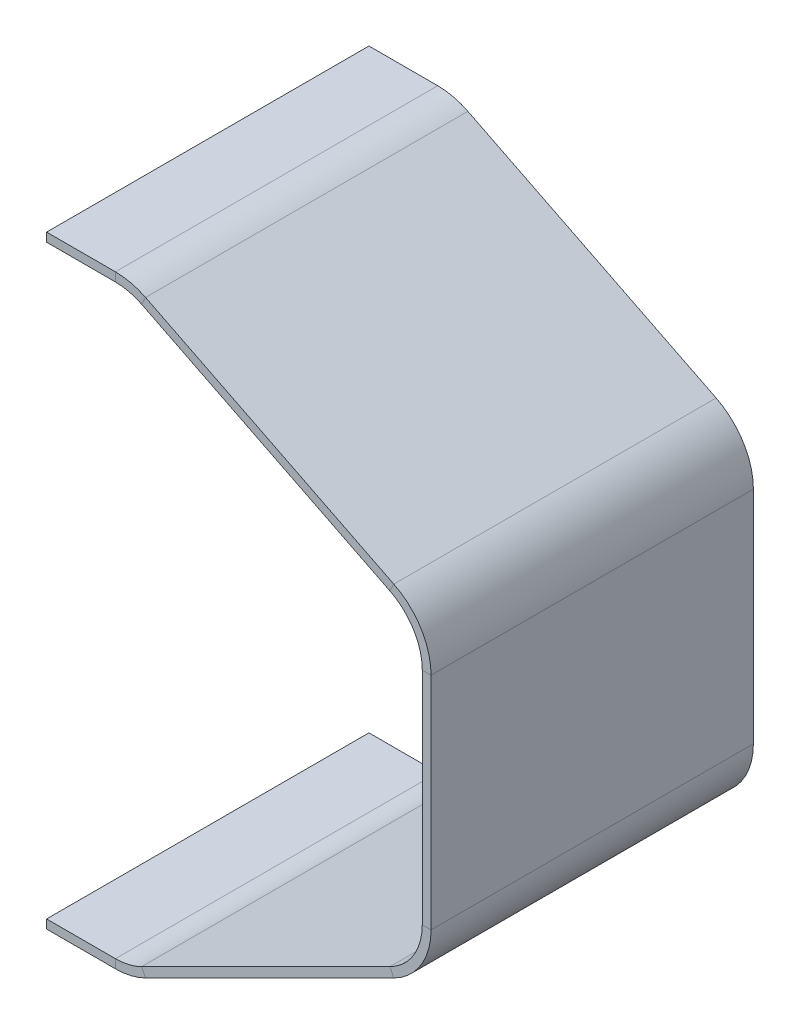
from build123d import *

# Parameters (mm, degrees)
BASE_FLANGE1_DEPTH = 55


# Sheet-metal steps are written as plain solids
with BuildPart() as part:
    # Sketch1 → Base-Flange1 (new body)
    with BuildSketch(Plane.XY):
        with BuildLine():
            Line((0, -50), (11.739320225, -50))
            ThreePointArc((11.739320225, -50), (14.03684943, -49.732489895), (16.21145618, -48.94427191))
            Line((16.21145618, -48.94427191), (58.572135955, -27.763932023))
            ThreePointArc((58.572135955, -27.763932023), (62.606508084, -24.076971234), (64.1, -18.819660113))
            Line((64.1, -18.819660113), (64.1, 18.819660113))
            ThreePointArc((64.1, 18.819660113), (62.606508084, 24.076971234), (58.572135955, 27.763932023))
            Line((58.572135955, 27.763932023), (16.21145618, 48.94427191))
            ThreePointArc((16.21145618, 48.94427191), (14.03684943, 49.732489895), (11.739320225, 50))
            Line((11.739320225, 50), (0, 50))
            Line((0, 50), (0, 51.5))
            Line((0, 51.5), (11.739320225, 51.5))
            ThreePointArc((11.739320225, 51.5), (14.381478811, 51.192363379), (16.882276573, 50.285912696))
            Line((16.882276573, 50.285912696), (59.242956348, 29.105572809))
            ThreePointArc((59.242956348, 29.105572809), (63.882484296, 24.865567902), (65.6, 18.819660113))
            Line((65.6, 18.819660113), (65.6, -18.819660113))
            ThreePointArc((65.6, -18.819660113), (63.882484296, -24.865567902), (59.242956348, -29.105572809))
            Line((59.242956348, -29.105572809), (16.882276573, -50.285912696))
            ThreePointArc((16.882276573, -50.285912696), (14.381478811, -51.192363379), (11.739320225, -51.5))
            Line((11.739320225, -51.5), (0, -51.5))
            Line((0, -51.5), (0, -50))
        make_face()
    extrude(amount=BASE_FLANGE1_DEPTH)


solid = part.part
